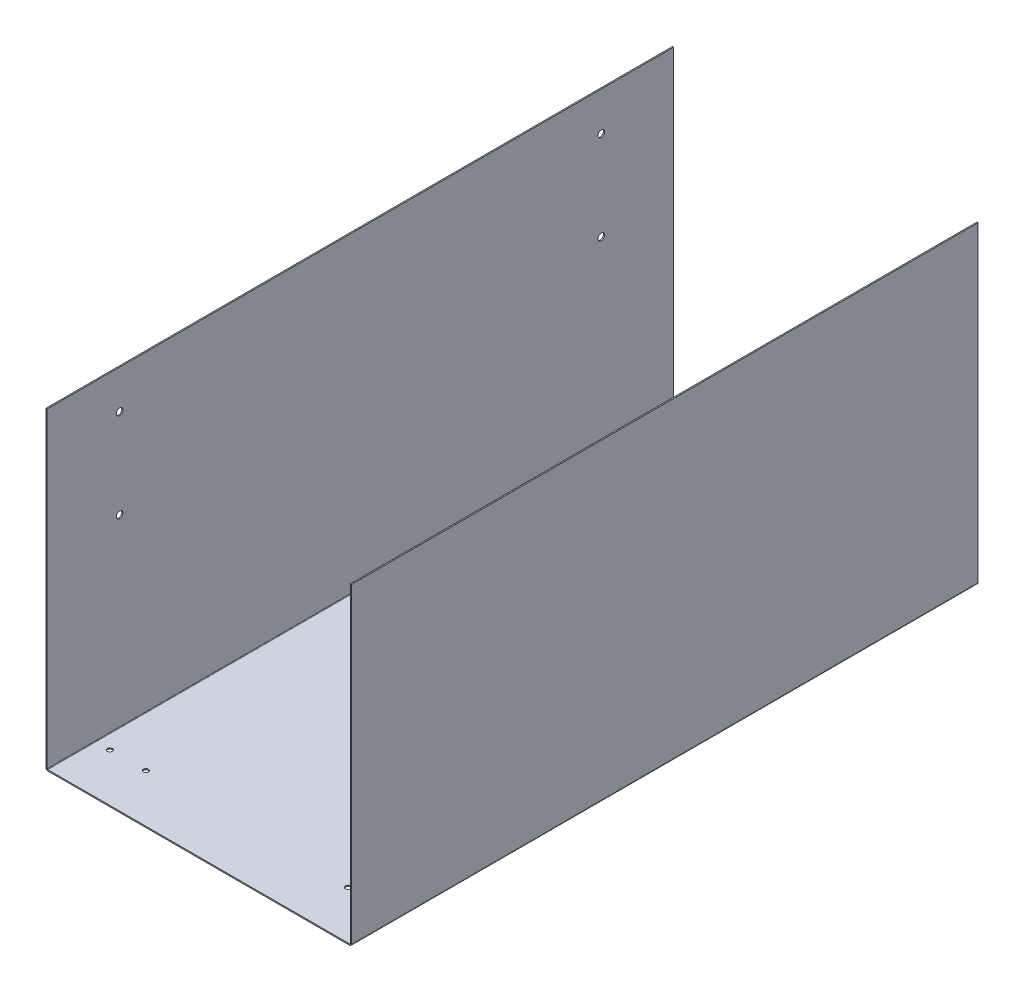
from build123d import *

# Parameters (mm, degrees)
TABAN_FLAN_1_DEPTH    = 400
IZIM2_R               = 4.25
KES_EKSTR_ZYON1_DEPTH = 10
IZIM3_R               = 3.25
KES_EKSTR_ZYON2_DEPTH = 10


# Sheet-metal steps are written as plain solids
with BuildPart() as part:
    # Çizim1 → Taban-Flanş1 (new, symmetric)
    with BuildSketch(Plane.XY):
        with BuildLine():
            Line((-195, 400), (-195, 2.2366))
            ThreePointArc((-195, 2.2366), (-194.344915027, 0.655084973), (-192.7634, 0))
            Line((-192.7634, 0), (192.7634, 0))
            ThreePointArc((192.7634, 0), (194.344915027, 0.655084973), (195, 2.2366))
            Line((195, 2.2366), (195, 400))
            Line((195, 400), (193.5, 400))
            Line((193.5, 400), (193.5, 2.2366))
            ThreePointArc((193.5, 2.2366), (193.284254855, 1.715745145), (192.7634, 1.5))
            Line((192.7634, 1.5), (-192.7634, 1.5))
            ThreePointArc((-192.7634, 1.5), (-193.284254855, 1.715745145), (-193.5, 2.2366))
            Line((-193.5, 2.2366), (-193.5, 400))
            Line((-193.5, 400), (-195, 400))
        make_face()
    extrude(amount=TABAN_FLAN_1_DEPTH, both=True)

    # Çizim2 → Kes-Ekstrüzyon1 (cut)
    with BuildSketch(Plane(origin=(-193.5, 0, 0), x_dir=(0, 0, -1), z_dir=(1, 0, 0))):
        with Locations((307.5, 350.5)):
            Circle(IZIM2_R)
        with Locations((307.5, 236.5)):
            Circle(IZIM2_R)
        with Locations(Location((-307.5, 236.5, 0), (0, 0, 180))):
            Circle(IZIM2_R)
        with Locations(Location((-307.5, 350.5, 0), (0, 0, 180))):
            Circle(IZIM2_R)
    extrude(amount=-KES_EKSTR_ZYON1_DEPTH, mode=Mode.SUBTRACT)

    # Çizim3 → Kes-Ekstrüzyon2 (cut)
    with BuildSketch(Plane.XZ):
        with Locations((-175, 338.5)):
            Circle(IZIM3_R)
        with Locations((-129, 338.5)):
            Circle(IZIM3_R)
        with Locations((175, 338.5)):
            Circle(IZIM3_R)
        with Locations((129, 338.5)):
            Circle(IZIM3_R)
        with Locations((-175, -338.5)):
            Circle(IZIM3_R)
        with Locations((-129, -338.5)):
            Circle(IZIM3_R)
        with Locations((129, -338.5)):
            Circle(IZIM3_R)
        with Locations((175, -338.5)):
            Circle(IZIM3_R)
    extrude(amount=-KES_EKSTR_ZYON2_DEPTH, mode=Mode.SUBTRACT)


solid = part.part
